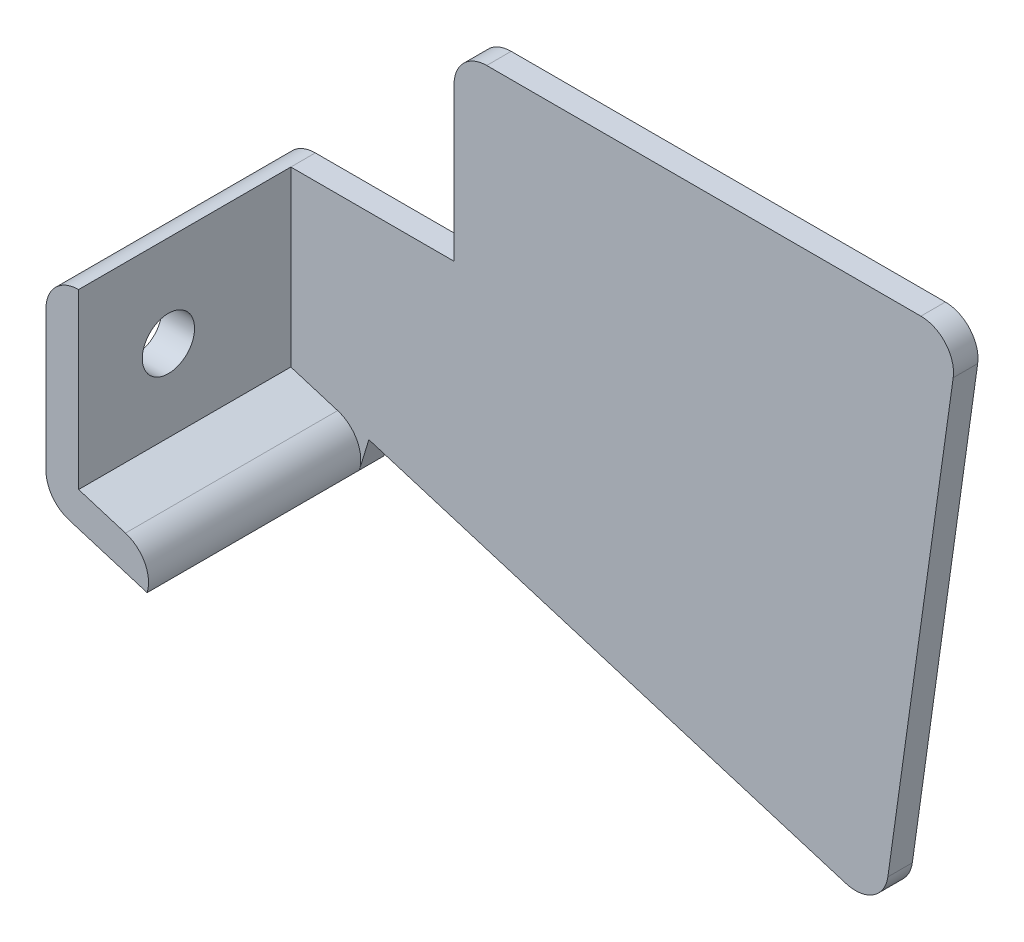
from build123d import *

# Parameters (mm, degrees)
BOSS_EXTRUDE1_DEPTH = 1.5
BOSS_EXTRUDE4_DEPTH = 14.5
FILLET3_R           = 2
CUT_EXTRUDE1_REACH  = 58.101
SKETCH7_R           = 1.6


with BuildPart() as part:
    # Sketch1 → Boss-Extrude1 (new body)
    with BuildSketch(Plane.XY):
        Polygon((-6.174224551, -3.411681894), (24.72754499, -3.411681894), (20.077965687, -36.495157687), (-18.174224551, -24.800289498), (-18.174224551, -14.800289498), (-6.174224551, -14.800289498), align=None)
    extrude(amount=BOSS_EXTRUDE1_DEPTH)

    # Sketch6 → Boss-Extrude4 (add)
    with BuildSketch(Plane(origin=(0, 0, 0), x_dir=(-1, 0, 0), z_dir=(0, 0, -1))):
        Polygon((16.174224551, -25.411750861), (11.392700771, -26.873609384), (11.977444181, -28.786218896), (18.174224551, -26.891673011), (18.174224551, -14.800289498), (16.174224551, -14.800289498), align=None)
    extrude(amount=-BOSS_EXTRUDE4_DEPTH)

    # Fillet3
    fillet3_edges = [part.edges().sort_by_distance(p)[0] for p in [
        (-18.174224551, -26.891673011, 7.25),
        (20.077965687, -36.495157687, 0.75),
        (-6.174224551, -3.411681894, 0.75),
        (24.72754499, -3.411681894, 0.75),
        (-11.392700771, -26.873609384, 8),
        (-18.174224551, -14.800289498, 7.25),
    ]]
    fillet(fillet3_edges, radius=FILLET3_R - 0.0001)  # a hair under: the kernel refuses the full size

    # Sketch7 → Cut-Extrude1 (cut, up to next)
    with BuildSketch(Plane(origin=(-16.174224551, 0, 0), x_dir=(0, 0, -1), z_dir=(1, 0, 0)), mode=Mode.PRIVATE) as cut_extrude1_sk1:
        with Locations((-9, -20.411750861)):
            Circle(SKETCH7_R)
    cut_extrude1_tool1 = extrude(cut_extrude1_sk1.sketch, amount=-CUT_EXTRUDE1_REACH, mode=Mode.PRIVATE) & part.part
    add(cut_extrude1_tool1.solids().sort_by_distance((-16.174225, -20.411751, 9))[0], mode=Mode.SUBTRACT)


solid = part.part
